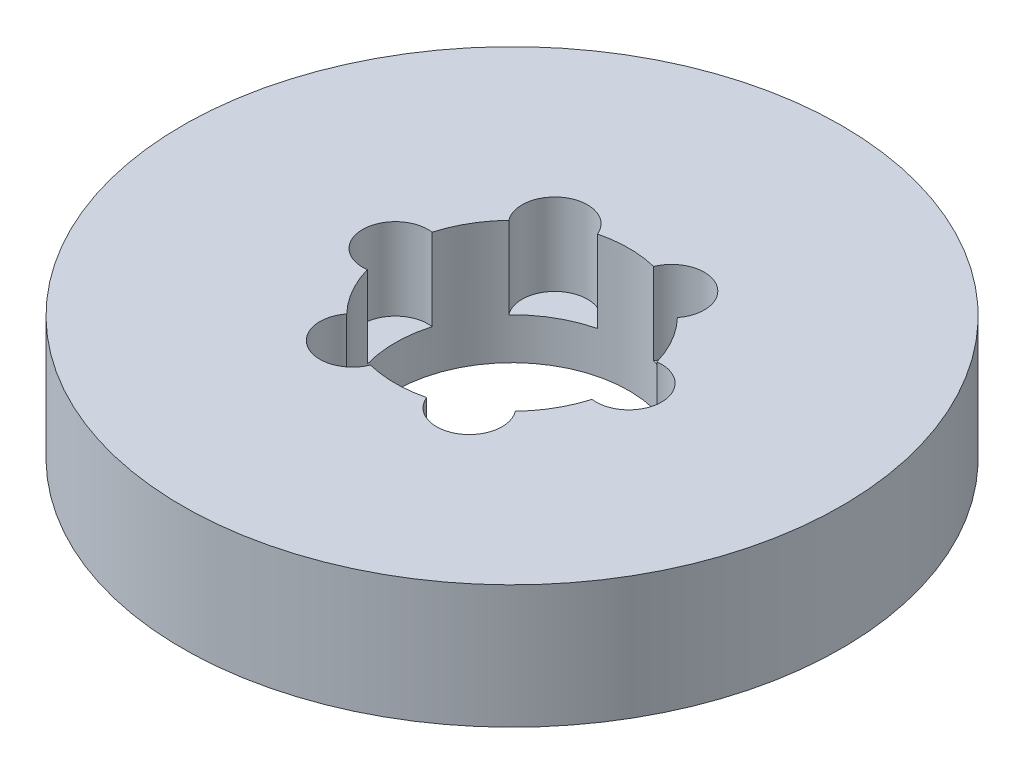
from build123d import *

# Parameters (mm, degrees)
SKETCH1_R           = 77.5
BOSS_EXTRUDE1_DEPTH = 29
SKETCH2_R           = 27.5
CUT_EXTRUDE1_DEPTH  = 114.373277275
SKETCH3_R           = 7.700443873
CUT_EXTRUDE2_DEPTH  = 19.238035331
CIRPATTERN1_COUNT   = 6


with BuildPart() as part:
    # Sketch1 → Boss-Extrude1 (new body)
    with BuildSketch(Plane(origin=(0, 0, 0), x_dir=(1, 0, 0), z_dir=(0, 1, 0))):
        Circle(SKETCH1_R)
    extrude(amount=BOSS_EXTRUDE1_DEPTH)

    # Sketch2 → Cut-Extrude1 (cut, through all)
    with BuildSketch(Plane(origin=(0, 0, 0), x_dir=(1, 0, 0), z_dir=(0, 1, 0))):
        Circle(SKETCH2_R)
    extrude(amount=CUT_EXTRUDE1_DEPTH, mode=Mode.SUBTRACT)

    # Sketch3 → Cut-Extrude2 (cut)
    with BuildSketch(Plane(origin=(0, 29, 0), x_dir=(1, 0, 0), z_dir=(0, 1, 0))):
        with Locations((-27.45428668, 0)):
            Circle(SKETCH3_R)
    cut_extrude2 = extrude(amount=-CUT_EXTRUDE2_DEPTH, mode=Mode.SUBTRACT)

    # CirPattern1: Cut-Extrude2 ×6 about axis
    cirpattern1_axis = Axis((0, 0, 0), (0, 1, 0))
    for i in range(1, CIRPATTERN1_COUNT):
        add(cut_extrude2.rotate(cirpattern1_axis, i * 360 / CIRPATTERN1_COUNT), mode=Mode.SUBTRACT)


solid = part.part
